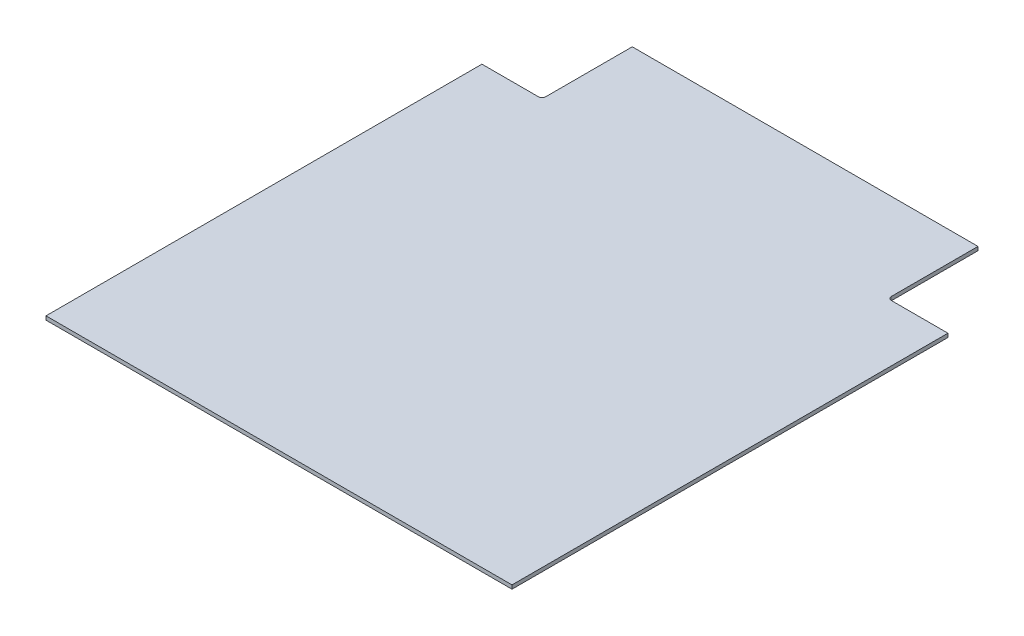
from build123d import *

# Parameters (mm, degrees)
SKETCH1_W           = 393.7
SKETCH1_H           = 444.5
BOSS_EXTRUDE1_DEPTH = 3.175
CUT_EXTRUDE1_DEPTH  = 10


with BuildPart() as part:
    # Sketch1 → Boss-Extrude1 (new body)
    with BuildSketch(Plane(origin=(0, 0, 0), x_dir=(1, 0, 0), z_dir=(0, 1, 0))):
        Rectangle(SKETCH1_W, SKETCH1_H)
    extrude(amount=BOSS_EXTRUDE1_DEPTH)

    # Sketch2 → Cut-Extrude1 (cut)
    with BuildSketch(Plane(origin=(0, 3.175, 0), x_dir=(1, 0, 0), z_dir=(0, 1, 0))):
        with BuildLine():
            Line((-196.85, 222.25), (-146.05, 222.25))
            Line((-146.05, 222.25), (-146.05, 149.225))
            ThreePointArc((-146.05, 149.225), (-146.97993597, 146.97993597), (-149.225, 146.05))
            Line((-149.225, 146.05), (-196.85, 146.05))
            Line((-196.85, 146.05), (-196.85, 222.25))
        make_face()
        with BuildLine():
            Line((196.85, 222.25), (146.05, 222.25))
            Line((146.05, 222.25), (146.05, 149.225))
            ThreePointArc((146.05, 149.225), (146.97993597, 146.97993597), (149.225, 146.05))
            Line((149.225, 146.05), (196.85, 146.05))
            Line((196.85, 146.05), (196.85, 222.25))
        make_face()
    extrude(amount=-CUT_EXTRUDE1_DEPTH, mode=Mode.SUBTRACT)


solid = part.part
